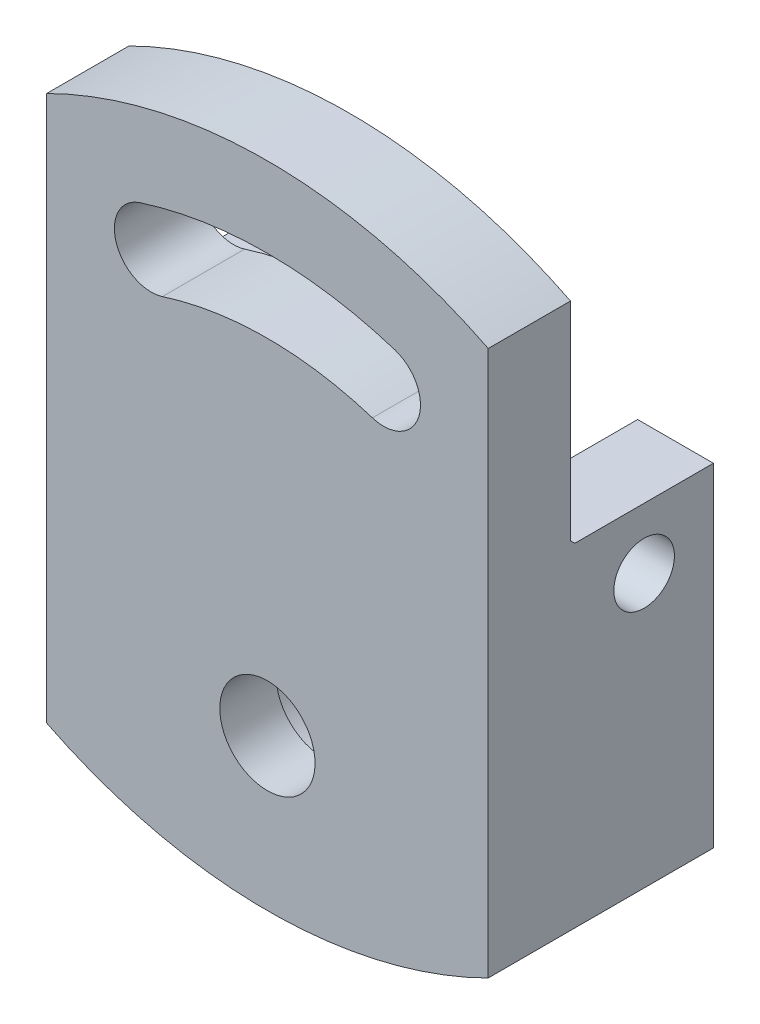
from build123d import *

# Parameters (mm, degrees)
Y_KSEKLIK_EKSTR_ZYON1_DEPTH      = 10
KES_EKSTR_ZYON1_DEPTH            = 159.748228337
KES_EKSTR_ZYON1_DEPTH_BACK       = 159.748228337
IZIM3_W                          = 1
IZIM3_H                          = 61
PAH1_SIZE                        = 1
Y_KSEKLIK_EKSTR_ZYON2_DEPTH      = 51
Y_KSEKLIK_EKSTR_ZYON2_DEPTH_BACK = 51
IZIM4_W                          = 32
IZIM4_H                          = 89
KES_EKSTR_ZYON2_DEPTH            = 162.632298752
IZIM8_W                          = 32
IZIM8_H                          = 89
KES_EKSTR_ZYON3_DEPTH            = 33.5
KES_EKSTR_ZYON4_DEPTH            = 164.905460556
KES_EKSTR_ZYON4_DEPTH_BACK       = 164.905460556
IZIM9_R                          = 7
KES_EKSTR_ZYON5_DEPTH            = 164.905460556
KES_EKSTR_ZYON5_DEPTH_BACK       = 164.905460556


with BuildPart() as part:
    # Çizim2 → Yükseklik-Ekstrüzyon1 (new, symmetric)
    with BuildSketch(Plane.XY):
        with BuildLine():
            Line((-51, 12.044127192), (-51, 137.955872808))
            ThreePointArc((-51, 137.955872808), (0, 150), (51, 137.955872808))
            Line((51, 137.955872808), (51, 12.044127192))
            ThreePointArc((51, 12.044127192), (0, 0), (-51, 12.044127192))
        make_face()
    extrude(amount=Y_KSEKLIK_EKSTR_ZYON1_DEPTH, both=True)

    # Çizim3 → Kes-Ekstrüzyon1 (cut, two sides: drawn at the far end of the back side and taken through both)
    with BuildSketch(Plane(origin=(0, 0, 0), x_dir=(0, 0, -1), z_dir=(1, 0, 0)).offset(-KES_EKSTR_ZYON1_DEPTH_BACK)):
        with Locations((9.5, 119.5)):
            Rectangle(IZIM3_W, IZIM3_H)
    extrude(amount=KES_EKSTR_ZYON1_DEPTH + KES_EKSTR_ZYON1_DEPTH_BACK, mode=Mode.SUBTRACT)

    # Pah1
    pah1_edges = [part.edges().sort_by_distance(p)[0] for p in [
        (0, 89, -9),
    ]]
    chamfer(pah1_edges, length=PAH1_SIZE - 0.0001)  # a hair under: the kernel refuses the full size

    # Çizim4 → Yükseklik-Ekstrüzyon2 (add, two sides: drawn at the far end of the back side and taken through both)
    with BuildSketch(Plane(origin=(0, 0, 0), x_dir=(0, 0, -1), z_dir=(1, 0, 0)).offset(-Y_KSEKLIK_EKSTR_ZYON2_DEPTH_BACK)):
        with Locations((26, 44.5)):
            Rectangle(IZIM4_W, IZIM4_H)
    extrude(amount=Y_KSEKLIK_EKSTR_ZYON2_DEPTH + Y_KSEKLIK_EKSTR_ZYON2_DEPTH_BACK)

    # Çizim7 → Kes-Ekstrüzyon2 (cut, through all)
    with BuildSketch(Plane.XY.offset(-10)):
        with BuildLine():
            ThreePointArc((0, 0), (-26.201436028, 3.051882621), (-51, 12.044127192))
            Line((-51, 12.044127192), (-51, 0))
            Line((-51, 0), (0, 0))
        make_face()
        with BuildLine():
            ThreePointArc((51, 12.044127192), (26.201436028, 3.051882621), (0, 0))
            Line((0, 0), (51, 0))
            Line((51, 0), (51, 12.044127192))
        make_face()
    extrude(amount=-KES_EKSTR_ZYON2_DEPTH, mode=Mode.SUBTRACT)

    # Çizim8 → Kes-Ekstrüzyon3 (cut, symmetric)
    with BuildSketch(Plane(origin=(0, 0, 0), x_dir=(0, 0, -1), z_dir=(1, 0, 0))):
        with Locations((26, 44.5)):
            Rectangle(IZIM8_W, IZIM8_H)
    extrude(amount=KES_EKSTR_ZYON3_DEPTH, both=True, mode=Mode.SUBTRACT)

    # Çizim9 → Kes-Ekstrüzyon4 (cut, two sides: drawn at the far end of the back side and taken through both)
    with BuildSketch(Plane(origin=(0, 0, 0), x_dir=(0, 0, -1), z_dir=(1, 0, 0)).offset(-KES_EKSTR_ZYON4_DEPTH_BACK)):
        with Locations((26, 75)):
            Circle(IZIM9_R)
    extrude(amount=KES_EKSTR_ZYON4_DEPTH + KES_EKSTR_ZYON4_DEPTH_BACK, mode=Mode.SUBTRACT)

    # Çizim10 → Kes-Döndür1 (revolve, cut)
    with BuildSketch(Plane(origin=(0, 0, 0), x_dir=(0, 0, -1), z_dir=(1, 0, 0)), mode=Mode.PRIVATE) as kes_d_nd_r1_sk:
        Polygon((-10, 35), (-10, 46), (3, 46), (3, 50), (10, 50), (10, 35), align=None)
    revolve(kes_d_nd_r1_sk.sketch.rotate(Axis((0, 35, 10), (0, 0, -1)), 90), axis=Axis((0, 35, 10), (0, 0, -1)), mode=Mode.SUBTRACT)

    # Çizim11 → Kes-Ekstrüzyon5 (cut, two sides: drawn at the far end of the back side and taken through both)
    with BuildSketch(Plane.XY.offset(-KES_EKSTR_ZYON5_DEPTH_BACK)):
        with BuildLine():
            ThreePointArc((29.436953678, 126.900575396), (0, 131.5), (-29.436953678, 126.900575396))
            ThreePointArc((-29.436953678, 126.900575396), (-34.938930721, 116.212813768), (-24.251169092, 110.710836725))
            ThreePointArc((-24.251169092, 110.710836725), (0, 114.5), (24.251169092, 110.710836725))
            ThreePointArc((24.251169092, 110.710836725), (34.938930721, 116.212813768), (29.436953678, 126.900575396))
        make_face()
    extrude(amount=KES_EKSTR_ZYON5_DEPTH + KES_EKSTR_ZYON5_DEPTH_BACK, mode=Mode.SUBTRACT)


solid = part.part
